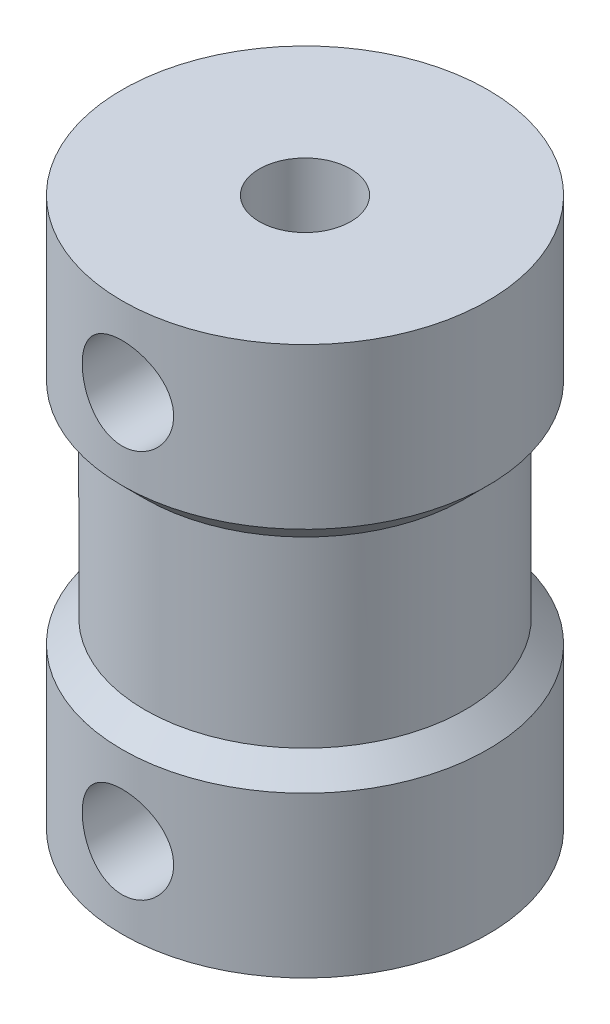
from build123d import *

# Parameters (mm, degrees)
SKETCH1_R           = 4
SKETCH1_R_2         = 1
BOSS_EXTRUDE1_DEPTH = 6
SKETCH2_R           = 10.066838553
SKETCH2_R_2         = 3.5
CUT_EXTRUDE1_DEPTH  = 3
CHAMFER1_SIZE       = 1
SKETCH3_R           = 1
CUT_EXTRUDE2_DEPTH  = 9.246211251


with BuildPart() as part:
    # Sketch1 → Boss-Extrude1 (new, symmetric)
    with BuildSketch(Plane(origin=(0, 0, 0), x_dir=(1, 0, 0), z_dir=(0, 1, 0))):
        with Locations(Location((0, 0, 0), (0, 0, 270))):
            Circle(SKETCH1_R)
        with Locations(Location((0, 0, 0), (0, 0, 270))):
            Circle(SKETCH1_R_2, mode=Mode.SUBTRACT)
    extrude(amount=BOSS_EXTRUDE1_DEPTH, both=True)

    # Sketch2 → Cut-Extrude1 (cut, symmetric)
    with BuildSketch(Plane(origin=(0, 0, 0), x_dir=(1, 0, 0), z_dir=(0, 1, 0))):
        Circle(SKETCH2_R)
        with Locations(Location((0, 0, 0), (0, 0, 270))):
            Circle(SKETCH2_R_2, mode=Mode.SUBTRACT)
    extrude(amount=CUT_EXTRUDE1_DEPTH, both=True, mode=Mode.SUBTRACT)

    # Chamfer1
    # the kernel refuses this chamfer: 1 mm, written as the material it adds along each edge
    with BuildSketch(Plane(origin=(0, -3, 0), x_dir=(0, 0, 1), z_dir=(-1, 0, 0))) as chamfer1_piece_1_section:
        Polygon((3.5 + CHAMFER1_SIZE, 0), (3.5, CHAMFER1_SIZE), (3.5, 0), align=None)
    chamfer1_piece_1 = revolve(axis=Axis((0, -3, 0), (0, 1, 0)), mode=Mode.PRIVATE)
    chamfer1_piece_1 = chamfer1_piece_1 & Plane(origin=(0, -2.250849305, 0), x_dir=(0, 0, 1), z_dir=(0, 1, 0)) * Cylinder(4, 18, mode=Mode.PRIVATE)
    add(chamfer1_piece_1)
    with BuildSketch(Plane(origin=(0, 3, 0), x_dir=(0, 0, 1), z_dir=(-1, 0, 0))) as chamfer1_piece_2_section:
        Polygon((3.5, -CHAMFER1_SIZE), (3.5 + CHAMFER1_SIZE, 0), (3.5, 0), align=None)
    chamfer1_piece_2 = revolve(axis=Axis((0, 3, 0), (0, 1, 0)), mode=Mode.PRIVATE)
    chamfer1_piece_2 = chamfer1_piece_2 & Plane(origin=(0, 2.250849305, 0), x_dir=(0, 0, 1), z_dir=(0, 1, 0)) * Cylinder(4, 18, mode=Mode.PRIVATE)
    add(chamfer1_piece_2)

    # Sketch3 → Cut-Extrude2 (cut, through all)
    with BuildSketch(Plane.XY):
        with Locations(Location((0, 4.25, 0), (0, 0, 270))):
            Circle(SKETCH3_R)
        with Locations(Location((0, -4.25, 0), (0, 0, 270))):
            Circle(SKETCH3_R)
    extrude(amount=CUT_EXTRUDE2_DEPTH, mode=Mode.SUBTRACT)


solid = part.part
